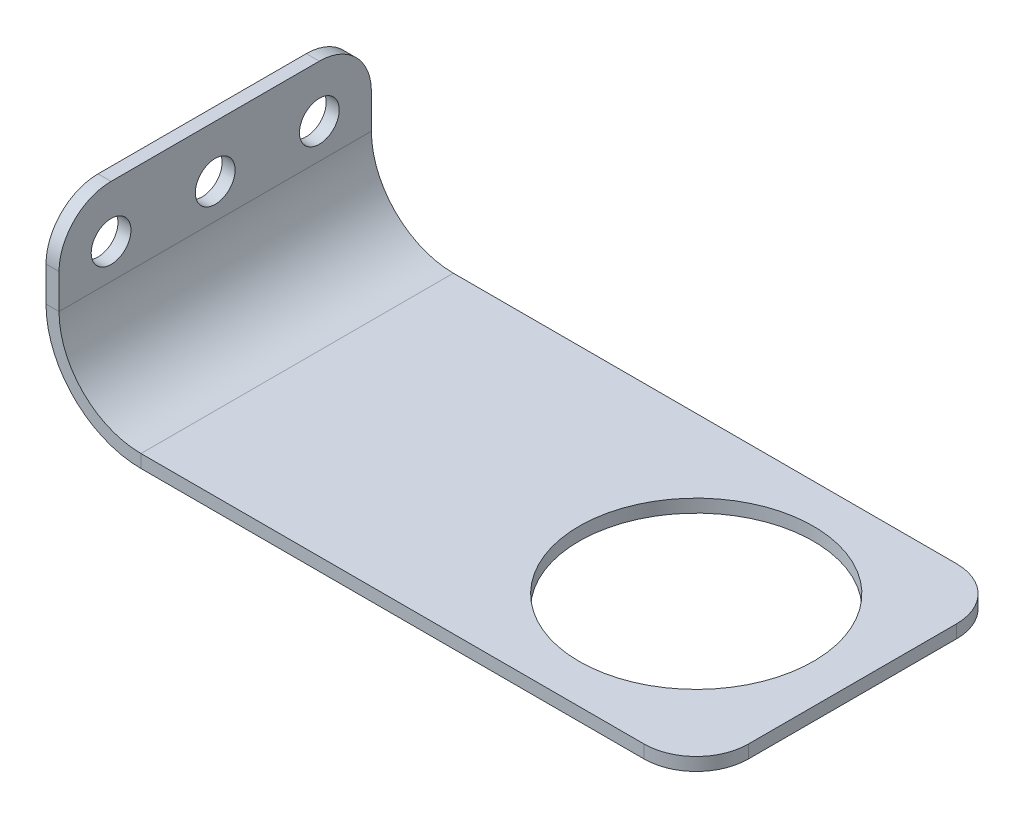
from build123d import *

# Parameters (mm, degrees)
SKETCH1_W                  = 19.05
SKETCH1_H                  = 38.1
SKETCH1_R                  = 2.425
SKETCH1_R_2                = 14.2875
BOSS_EXTRUDE2_DEPTH        = 1.5875
FILLET2_R                  = 6.35
SKETCHED_BEND2_OUTLINE_W   = 1.5875
SKETCHED_BEND2_OUTLINE_H   = 38.1
SKETCHED_BEND2_DEPTH       = 17.527391426
SKETCHED_START             = 15.939891426
SKETCHED_BEND2_2_OUTLINE_R = 2.425
SKETCHED_BEND2_2_DEPTH     = 11.5875
SKETCHED_START_2           = -38.1
SKETCHED_BEND2_3_DEPTH     = 38.1


with BuildPart() as part:
    # Sketch1 → Boss-Extrude2 (new body)
    # profile 1 of 3: a face of its own
    with BuildSketch(Plane(origin=(0, 0, 0), x_dir=(1, 0, 0), z_dir=(0, 1, 0))):
        with Locations((9.525, 19.05)):
            Rectangle(SKETCH1_W, SKETCH1_H)
        with Locations(Location((6.35, 6.35, 0), (0, 0, 270))):
            Circle(SKETCH1_R, mode=Mode.SUBTRACT)
        with Locations(Location((6.35, 19.05, 0), (0, 0, 270))):
            Circle(SKETCH1_R, mode=Mode.SUBTRACT)
        with Locations(Location((6.35, 31.75, 0), (0, 0, 270))):
            Circle(SKETCH1_R, mode=Mode.SUBTRACT)
    # profile 2 of 3: a face of its own
    with BuildSketch(Plane(origin=(0, 0, 0), x_dir=(1, 0, 0), z_dir=(0, 1, 0))):
        Polygon((19.05, 38.1), (19.05, 0), (50.8, 0), (95.25, 0), (95.25, 38.1), (50.8, 38.1), align=None)
        with Locations(Location((76.2, 19.05, 0), (0, 0, 270))):
            Circle(SKETCH1_R_2, mode=Mode.SUBTRACT)
    # profile 3 of 3: a face of its own
    with BuildSketch(Plane(origin=(0, 0, 0), x_dir=(1, 0, 0), z_dir=(0, 1, 0))):
        Polygon((19.05, 38.1), (19.05, 0), (50.8, 0), (95.25, 0), (95.25, 38.1), (50.8, 38.1), align=None)
        with Locations(Location((76.2, 19.05, 0), (0, 0, 270))):
            Circle(SKETCH1_R_2, mode=Mode.SUBTRACT)
    extrude(amount=BOSS_EXTRUDE2_DEPTH)

    # Fillet2
    fillet2_edges = [part.edges().sort_by_distance(p)[0] for p in [
        (0, 0.79375, 0),
        (0, 0.79375, -38.1),
        (95.25, 0.79375, -38.1),
        (95.25, 0.79375, 0),
    ]]
    fillet(fillet2_edges, radius=FILLET2_R)

    # Sketched Bend2: read off the stored shape, not the designer's step
    # Sketched Bend2 outline → Sketched Bend2 (cut)
    with BuildSketch(Plane.YZ):
        with Locations((0.79375, -19.05)):
            Rectangle(SKETCHED_BEND2_OUTLINE_W, SKETCHED_BEND2_OUTLINE_H)
    extrude(amount=SKETCHED_BEND2_DEPTH, mode=Mode.SUBTRACT)

    # Sketched Bend2 2 outline → Sketched Bend2 2 (add)
    with BuildSketch(Plane.YZ.offset(SKETCHED_START)):
        with BuildLine():
            Line((1.5875, -38.1), (15.810108574, -38.1))
            ThreePointArc((15.810108574, -38.1), (20.300236634, -36.240128061), (22.160108574, -31.75))
            Line((22.160108574, -31.75), (22.160108574, -6.35))
            ThreePointArc((22.160108574, -6.35), (20.300236634, -1.859871939), (15.810108574, 0))
            Line((15.810108574, 0), (1.5875, 0))
            Line((1.5875, 0), (1.5875, -38.1))
        make_face()
        with Locations((15.810108574, -31.75)):
            Circle(SKETCHED_BEND2_2_OUTLINE_R, mode=Mode.SUBTRACT)
        with Locations((15.810108574, -19.05)):
            Circle(SKETCHED_BEND2_2_OUTLINE_R, mode=Mode.SUBTRACT)
        with Locations((15.810108574, -6.35)):
            Circle(SKETCHED_BEND2_2_OUTLINE_R, mode=Mode.SUBTRACT)
    extrude(amount=SKETCHED_BEND2_2_DEPTH)

    # Sketched Bend2 3 outline → Sketched Bend2 3 (cut)
    with BuildSketch(Plane.XY.offset(SKETCHED_START_2)):
        with BuildLine():
            ThreePointArc((27.527391426, 0), (19.333791599, 3.393900173), (15.939891426, 11.5875))
            Line((15.939891426, 11.5875), (15.939891426, 1.5875))
            Line((15.939891426, 1.5875), (17.527391426, 1.5875))
            Line((17.527391426, 1.5875), (17.527391426, 0))
            Line((17.527391426, 0), (27.527391426, 0))
        make_face()
        with BuildLine():
            Line((17.527391426, 22.160108574), (17.527391426, 11.5875))
            ThreePointArc((17.527391426, 11.5875), (20.456323614, 4.516432188), (27.527391426, 1.5875))
            Line((27.527391426, 1.5875), (27.527391426, 22.160108574))
            Line((27.527391426, 22.160108574), (17.527391426, 22.160108574))
        make_face()
    extrude(amount=SKETCHED_BEND2_3_DEPTH, mode=Mode.SUBTRACT)


solid = part.part
